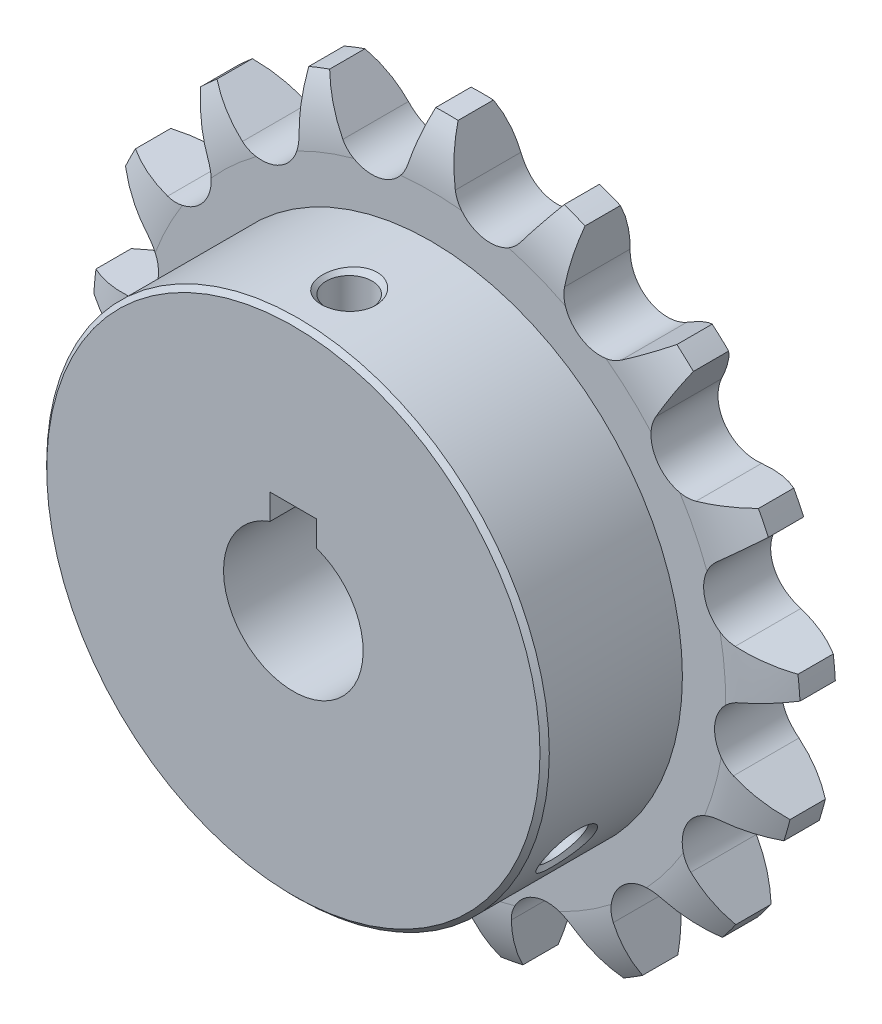
from build123d import *

# Parameters (mm, degrees)
SKETCH2_R          = 69.12
CUT_EXTRUDE1_DEPTH = 7.2
SKETCH5_W          = 5
SKETCH5_H          = 9.8
CUT_EXTRUDE2_DEPTH = 22


with BuildPart() as part:
    # Sketch1 → Revolve1 (revolve)
    with BuildSketch(Plane(origin=(0, 0, 0), x_dir=(0, 0, -1), z_dir=(1, 0, 0))):
        with BuildLine():
            Line((-22, 7.5), (0, 7.5))
            Line((0, 7.5), (0, 31.649616664))
            ThreePointArc((0, 31.649616664), (-0.43276813, 34.936816966), (-1.701580086, 38))
            Line((-1.701580086, 38), (-5.498419914, 38))
            ThreePointArc((-5.498419914, 38), (-6.76723187, 34.936816966), (-7.2, 31.649616664))
            Line((-7.2, 31.649616664), (-7.2, 27))
            Line((-7.2, 27), (-21.5, 27))
            Line((-21.5, 27), (-22, 26.5))
            Line((-22, 26.5), (-22, 7.5))
        make_face()
    revolve(axis=Axis((0, 0, 0), (0, 0, 1)))

    # Sketch2 → Cut-Extrude1 (cut)
    with BuildSketch(Plane.XY):
        Circle(SKETCH2_R)
        with BuildLine():
            Line((-37.948177074, 2.316104469), (-33.055554163, 0.531433919))
            ThreePointArc((-33.055554163, 0.531433919), (-30.469465795, -2.8234118), (-32.395069811, -6.596327386))
            Line((-32.395069811, -6.596327386), (-36.876454166, -9.249627628))
            Line((-36.876454166, -9.249627628), (-36.222294715, -11.548759617))
            Line((-36.222294715, -11.548759617), (-31.015362359, -11.445496091))
            ThreePointArc((-31.015362359, -11.445496091), (-27.391996715, -13.639593687), (-27.824634673, -17.853341098))
            Line((-27.824634673, -17.853341098), (-31.044918533, -21.946332642))
            Line((-31.044918533, -21.946332642), (-29.60439074, -23.853899723))
            Line((-29.60439074, -23.853899723), (-24.786374006, -21.876648433))
            ThreePointArc((-24.786374006, -21.876648433), (-20.615086696, -22.613672867), (-19.49632844, -26.699162166))
            Line((-19.49632844, -26.699162166), (-21.020594626, -31.679063823))
            Line((-21.020594626, -31.679063823), (-18.988249753, -32.937438492))
            Line((-18.988249753, -32.937438492), (-15.209848498, -29.353238181))
            ThreePointArc((-15.209848498, -29.353238181), (-11.053994985, -28.53365022), (-8.534935019, -31.939113439))
            Line((-8.534935019, -31.939113439), (-8.157322936, -37.133361895))
            Line((-8.157322936, -37.133361895), (-5.807640419, -37.572593681))
            Line((-5.807640419, -37.572593681), (-3.57914867, -32.86551046))
            ThreePointArc((-3.57914867, -32.86551046), (0, -30.6), (3.57914867, -32.86551046))
            Line((3.57914867, -32.86551046), (5.807640419, -37.572593681))
            Line((5.807640419, -37.572593681), (8.157322936, -37.133361895))
            Line((8.157322936, -37.133361895), (8.534935019, -31.939113439))
            ThreePointArc((8.534935019, -31.939113439), (11.053994985, -28.53365022), (15.209848498, -29.353238181))
            Line((15.209848498, -29.353238181), (18.988249753, -32.937438492))
            Line((18.988249753, -32.937438492), (21.020594626, -31.679063823))
            Line((21.020594626, -31.679063823), (19.49632844, -26.699162166))
            ThreePointArc((19.49632844, -26.699162166), (20.615086696, -22.613672867), (24.786374006, -21.876648433))
            Line((24.786374006, -21.876648433), (29.60439074, -23.853899723))
            Line((29.60439074, -23.853899723), (31.044918533, -21.946332642))
            Line((31.044918533, -21.946332642), (27.824634673, -17.853341098))
            ThreePointArc((27.824634673, -17.853341098), (27.391996715, -13.639593687), (31.015362359, -11.445496091))
            Line((31.015362359, -11.445496091), (36.222294715, -11.548759617))
            Line((36.222294715, -11.548759617), (36.876454166, -9.249627628))
            Line((36.876454166, -9.249627628), (32.395069811, -6.596327386))
            ThreePointArc((32.395069811, -6.596327386), (30.469465795, -2.8234118), (33.055554163, 0.531433919))
            Line((33.055554163, 0.531433919), (37.948177074, 2.316104469))
            Line((37.948177074, 2.316104469), (37.727620325, 4.696290851))
            Line((37.727620325, 4.696290851), (32.590371264, 5.551556892))
            ThreePointArc((32.590371264, 5.551556892), (29.431864681, 8.374087496), (30.63141021, 12.436590834))
            Line((30.63141021, 12.436590834), (34.54894784, 15.868165812))
            Line((34.54894784, 15.868165812), (33.483462303, 18.007949227))
            Line((33.483462303, 18.007949227), (28.384162488, 16.949672648))
            ThreePointArc((28.384162488, 16.949672648), (24.419327155, 18.440619873), (24.070324574, 22.662117243))
            Line((24.070324574, 22.662117243), (26.483691759, 27.277143434))
            Line((26.483691759, 27.277143434), (24.717177158, 28.887534274))
            Line((24.717177158, 28.887534274), (20.344515286, 26.058641193))
            ThreePointArc((20.344515286, 26.058641193), (16.108824184, 26.016644353), (14.258408225, 29.826999144))
            Line((14.258408225, 29.826999144), (14.841666354, 35.002191688))
            Line((14.841666354, 35.002191688), (12.612700276, 35.865697747))
            Line((12.612700276, 35.865697747), (9.557228562, 31.648245848))
            ThreePointArc((9.557228562, 31.648245848), (5.622735245, 30.07897685), (2.520814838, 32.963579532))
            Line((2.520814838, 32.963579532), (1.195191668, 38))
            Line((1.195191668, 38), (-1.195191668, 38))
            Line((-1.195191668, 38), (-2.520814838, 32.963579532))
            ThreePointArc((-2.520814838, 32.963579532), (-5.622735245, 30.07897685), (-9.557228562, 31.648245848))
            Line((-9.557228562, 31.648245848), (-12.612700276, 35.865697747))
            Line((-12.612700276, 35.865697747), (-14.841666354, 35.002191688))
            Line((-14.841666354, 35.002191688), (-14.258408225, 29.826999144))
            ThreePointArc((-14.258408225, 29.826999144), (-16.108824184, 26.016644353), (-20.344515286, 26.058641193))
            Line((-20.344515286, 26.058641193), (-24.717177158, 28.887534274))
            Line((-24.717177158, 28.887534274), (-26.483691759, 27.277143434))
            Line((-26.483691759, 27.277143434), (-24.070324574, 22.662117243))
            ThreePointArc((-24.070324574, 22.662117243), (-24.419327155, 18.440619873), (-28.384162488, 16.949672648))
            Line((-28.384162488, 16.949672648), (-33.483462303, 18.007949227))
            Line((-33.483462303, 18.007949227), (-34.54894784, 15.868165812))
            Line((-34.54894784, 15.868165812), (-30.63141021, 12.436590834))
            ThreePointArc((-30.63141021, 12.436590834), (-29.431864681, 8.374087496), (-32.590371264, 5.551556892))
            Line((-32.590371264, 5.551556892), (-37.727620325, 4.696290851))
            Line((-37.727620325, 4.696290851), (-37.948177074, 2.316104469))
        make_face(mode=Mode.SUBTRACT)
    extrude(amount=CUT_EXTRUDE1_DEPTH, mode=Mode.SUBTRACT)

    # Sketch3 → Cut-Revolve1 (revolve, cut)
    with BuildSketch(Plane.XY.offset(16)):
        Polygon((0, 27), (3, 27), (2.4585, 26.4585), (2.4585, 0), (0, 0), align=None)
    revolve(axis=Axis((0, 0, 16), (0, 1, 0)), mode=Mode.SUBTRACT)

    # Sketch4 → Cut-Revolve2 (revolve, cut)
    with BuildSketch(Plane.XY.offset(16)):
        Polygon((23.382685902, -13.5), (21.882685902, -16.098076211), (21.684483146, -15.358373455), (-1.22925, -2.129123455), (0, 0), align=None)
    revolve(axis=Axis((0, 0, 16), (0.8660254037844402, -0.4999999999999975, 0)), mode=Mode.SUBTRACT)

    # Sketch5 → Cut-Extrude2 (cut)
    with BuildSketch(Plane.XY):
        with Locations((0, 4.9)):
            Rectangle(SKETCH5_W, SKETCH5_H)
    extrude(amount=CUT_EXTRUDE2_DEPTH, mode=Mode.SUBTRACT)


solid = part.part
